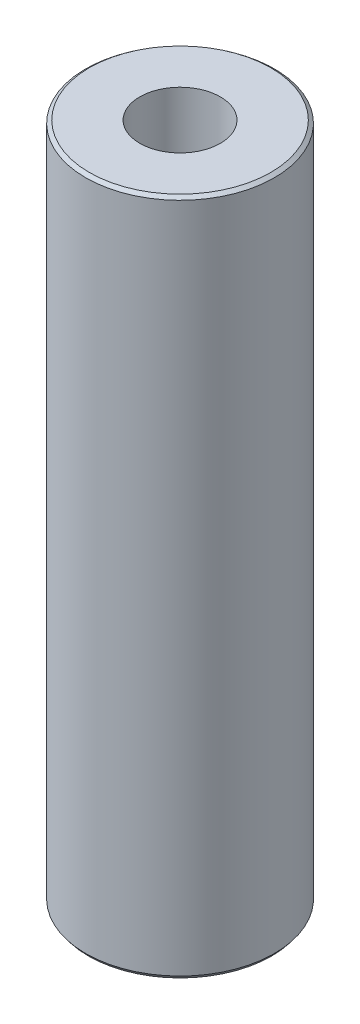
from build123d import *
from OCP.BRepFilletAPI import BRepFilletAPI_MakeChamfer

# Parameters (mm, degrees)
SKETCH1_R           = 25
BOSS_EXTRUDE1_DEPTH = 179.695013026
SKETCH2_R           = 10.676597455
CUT_EXTRUDE1_DEPTH  = 184.140104036
CHAMFER1_SIZE       = 0.733425088
CHAMFER1_SIZE2      = 0.959149269


with BuildPart() as part:
    # Sketch1 → Boss-Extrude1 (new body)
    with BuildSketch(Plane(origin=(0, 0, 0), x_dir=(1, 0, 0), z_dir=(0, 1, 0))):
        Circle(SKETCH1_R)
    extrude(amount=BOSS_EXTRUDE1_DEPTH)

    # Sketch2 → Cut-Extrude1 (cut, through all)
    with BuildSketch(Plane(origin=(0, 0, 0), x_dir=(1, 0, 0), z_dir=(0, 1, 0))):
        Circle(SKETCH2_R)
    extrude(amount=CUT_EXTRUDE1_DEPTH, mode=Mode.SUBTRACT)

    # Chamfer1: one chamfer whose edges measure the first distance from different faces: ONE call of the kernel's chamfer builder (chamfer() names one face for all edges)
    chamfer1_edges_1 = [part.edges().sort_by_distance(p)[0] for p in [
        (-25, 179.695013026, 0),
    ]]
    chamfer1_side_1 = [part.faces().sort_by_distance(p)[0] for p in [
        (-25, 89.847506513, 0),
    ]]
    chamfer1_edges_2 = [part.edges().sort_by_distance(p)[0] for p in [
        (-25, 0, 0),
    ]]
    chamfer1_side_2 = [part.faces().sort_by_distance(p)[0] for p in [
        (-24.292893219, 0, 0),
    ]]
    chamfer1 = BRepFilletAPI_MakeChamfer(part.part.solid().wrapped)
    for e in chamfer1_edges_1:
        chamfer1.Add(CHAMFER1_SIZE, CHAMFER1_SIZE2, e.wrapped, chamfer1_side_1[0].wrapped)  # the first distance lies on this face
    for e in chamfer1_edges_2:
        chamfer1.Add(CHAMFER1_SIZE, CHAMFER1_SIZE2, e.wrapped, chamfer1_side_2[0].wrapped)  # the first distance lies on this face
    add(Compound.cast(chamfer1.Shape()), mode=Mode.REPLACE)


solid = part.part
